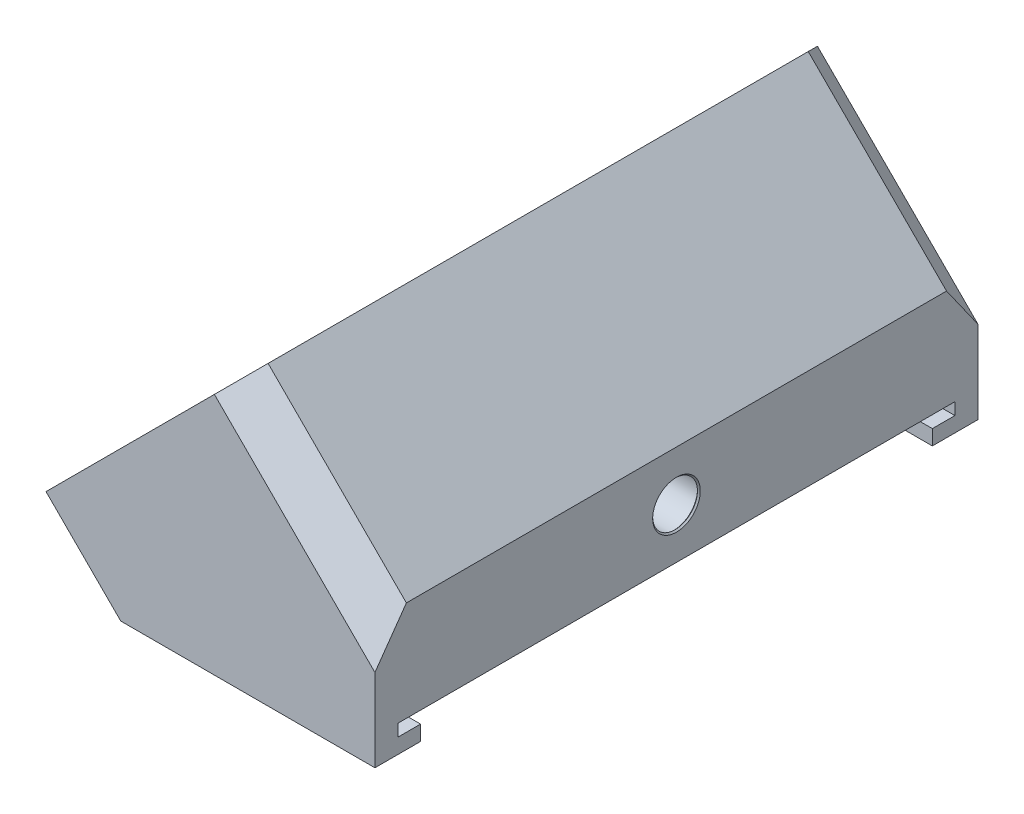
from build123d import *

# Parameters (mm, degrees)
BOSS_EXTRUDE1_DEPTH  = 160.26
SKETCH2_OUTSIDE_W    = 201.942
SKETCH2_OUTSIDE_H    = 157.534
SKETCH2_OUTSIDE_W_2  = 160.26
SKETCH2_OUTSIDE_H_2  = 80
SKETCH2_OUTSIDE_W_3  = 136
SKETCH2_OUTSIDE_H_3  = 74
CUT_EXTRUDE1_DEPTH   = 156
SKETCH11_R           = 1.778
CUT_EXTRUDE8_DEPTH   = 6
BOSS_EXTRUDE14_REACH = 475.056
SKETCH19_W           = 148
SKETCH19_H           = 3.2
CUT_EXTRUDE13_DEPTH  = 79.12
SKETCH24_W           = 136
SKETCH24_H           = 4
CUT_EXTRUDE15_DEPTH  = 3
BOSS_EXTRUDE16_REACH = 475.056
CHAMFER2_SIZE        = 8.36
CUT_EXTRUDE19_REACH  = 467.887
SKETCH31_W           = 25
SKETCH31_H           = 6
SKETCH32_R           = 6.7
CUT_EXTRUDE20_DEPTH  = 10
SKETCH33_R           = 9.2
SKETCH33_R_2         = 6.7
BOSS_EXTRUDE17_DEPTH = 10
SKETCH34_R           = 9
SKETCH34_R_2         = 5.5
BOSS_EXTRUDE18_DEPTH = 2
SKETCH35_R           = 6.7
SKETCH35_R_2         = 5.95
BOSS_EXTRUDE19_DEPTH = 0.75
CHAMFER4_SIZE        = 0.375
SKETCH36_W           = 136
SKETCH36_H           = 25.327231326
SKETCH36_R           = 9.2
BOSS_EXTRUDE20_DEPTH = 10
BOSS_EXTRUDE21_DEPTH = 136
SKETCH38_R           = 2.55
CUT_EXTRUDE23_DEPTH  = 3.8
SKETCH39_R           = 1.8
CUT_EXTRUDE24_DEPTH  = 5


with BuildPart() as part:
    # Sketch1 → Boss-Extrude1 (new body)
    with BuildSketch(Plane.XY):
        Polygon((352.367164448, 53.75754858), (431.734377425, 53.75754858), (431.734377425, 87.527420593), (394.983805142, 124.277992876), (338.415262647, 67.709450381), align=None)
    extrude(amount=BOSS_EXTRUDE1_DEPTH)

    # Sketch2 outside → Cut-Extrude1 (cut)
    # profile 1 of 2: a face of its own
    with BuildSketch(Plane(origin=(135.352906133, -135.352906133, 0), x_dir=(0, 0, 1), z_dir=(-0.7071067811865476, 0.7071067811865476, 0))):
        with Locations((80.13, 335.234)):
            Rectangle(SKETCH2_OUTSIDE_W, SKETCH2_OUTSIDE_H)
        with Locations((80.13, 327.17353859)):
            Rectangle(SKETCH2_OUTSIDE_W_2, SKETCH2_OUTSIDE_H_2, mode=Mode.SUBTRACT)
    # profile 2 of 2: a face of its own
    with BuildSketch(Plane(origin=(135.352906133, -135.352906133, 0), x_dir=(0, 0, 1), z_dir=(-0.7071067811865476, 0.7071067811865476, 0))):
        with Locations((80.13, 327.17353859)):
            Rectangle(SKETCH2_OUTSIDE_W_3, SKETCH2_OUTSIDE_H_3)
    extrude(amount=-CUT_EXTRUDE1_DEPTH, mode=Mode.SUBTRACT)

    # Sketch11 → Cut-Extrude8 (cut)
    with BuildSketch(Plane(origin=(135.352906133, -135.352906133, 0), x_dir=(0, 0, 1), z_dir=(-0.7071067811865476, 0.7071067811865476, 0))):
        with Locations(Location((7.63, 353.58853859, 0), (0, 0, 270))):
            Circle(SKETCH11_R)
        with Locations(Location((7.63, 300.75853859, 0), (0, 0, 270))):
            Circle(SKETCH11_R)
        with Locations(Location((152.63, 353.58853859, 0), (0, 0, 270))):
            Circle(SKETCH11_R)
        with Locations(Location((152.63, 300.75853859, 0), (0, 0, 270))):
            Circle(SKETCH11_R)
    extrude(amount=-CUT_EXTRUDE8_DEPTH, mode=Mode.SUBTRACT)

    # Sketch17 → Boss-Extrude14 (add, up to next)
    with BuildSketch(Plane.XY.offset(12.13), mode=Mode.PRIVATE) as boss_extrude14_sk1:
        Polygon((431.734377425, 83.284779906), (431.734377425, 53.75754858), (428.734377425, 53.75754858), (428.734377425, 86.284779906), align=None)
    boss_extrude14_tool1 = extrude(boss_extrude14_sk1.sketch, amount=BOSS_EXTRUDE14_REACH, mode=Mode.PRIVATE) - part.part
    add(boss_extrude14_tool1.solids().sort_by_distance((430.210205, 69.28325, 12.13))[0])

    # Sketch19 → Cut-Extrude13 (cut)
    with BuildSketch(Plane(origin=(431.734377425, 0, 0), x_dir=(0, 0, -1), z_dir=(1, 0, 0))):
        with Locations((-80.13, 59.35754858)):
            Rectangle(SKETCH19_W, SKETCH19_H)
    extrude(amount=-CUT_EXTRUDE13_DEPTH, mode=Mode.SUBTRACT)

    # Sketch24 → Cut-Extrude15 (cut)
    with BuildSketch(Plane(origin=(431.734377425, 0, 0), x_dir=(0, 0, -1), z_dir=(1, 0, 0))):
        with Locations((-80.13, 55.75754858)):
            Rectangle(SKETCH24_W, SKETCH24_H)
    extrude(amount=-CUT_EXTRUDE15_DEPTH, mode=Mode.SUBTRACT)

    # Sketch29 → Boss-Extrude16 (add, up to next)
    with BuildSketch(Plane.XY.offset(12.13), mode=Mode.PRIVATE) as boss_extrude16_sk1:
        Polygon((356.609805135, 53.75754858), (372.609805135, 53.75754858), (372.609805135, 57.75754858), (352.609805135, 57.75754858), align=None)
    boss_extrude16_tool1 = extrude(boss_extrude16_sk1.sketch, amount=BOSS_EXTRUDE16_REACH, mode=Mode.PRIVATE) - part.part
    add(boss_extrude16_tool1.solids().sort_by_distance((363.572768, 55.831623, 12.13))[0])

    # Chamfer2
    chamfer2_edges = [part.edges().sort_by_distance(p)[0] for p in [
        (413.359091284, 105.902706735, 160.26),
        (345.391213548, 60.733499481, 160.26),
        (345.391213548, 60.733499481, 0),
        (413.359091284, 105.902706735, 0),
    ]]
    chamfer(chamfer2_edges, length=CHAMFER2_SIZE)

    # Sketch31 → Cut-Extrude19 (cut, up to next)
    with BuildSketch(Plane.XZ.offset(-53.75754858), mode=Mode.PRIVATE) as cut_extrude19_sk1:
        with Locations((385.109805135, 151.13)):
            Rectangle(SKETCH31_W, SKETCH31_H)
    cut_extrude19_tool1 = extrude(cut_extrude19_sk1.sketch, amount=-CUT_EXTRUDE19_REACH, mode=Mode.PRIVATE) & part.part
    # Sketch31 → Cut-Extrude19 (cut, up to next)
    with BuildSketch(Plane.XZ.offset(-53.75754858), mode=Mode.PRIVATE) as cut_extrude19_sk2:
        with Locations((385.109805135, 9.13)):
            Rectangle(SKETCH31_W, SKETCH31_H)
    cut_extrude19_tool2 = extrude(cut_extrude19_sk2.sketch, amount=-CUT_EXTRUDE19_REACH, mode=Mode.PRIVATE) & part.part
    add(cut_extrude19_tool1.solids().sort_by_distance((385.109805, 53.757549, 151.13))[0], mode=Mode.SUBTRACT)
    add(cut_extrude19_tool2.solids().sort_by_distance((385.109805, 53.757549, 9.13))[0], mode=Mode.SUBTRACT)

    # Sketch32 → Cut-Extrude20 (cut)
    with BuildSketch(Plane(origin=(431.734377425, 0, 0), x_dir=(0, 0, -1), z_dir=(1, 0, 0))):
        with Locations((-80.13, 74.242484587)):
            Circle(SKETCH32_R)
    extrude(amount=-CUT_EXTRUDE20_DEPTH, mode=Mode.SUBTRACT)

    # Sketch33 → Boss-Extrude17 (add)
    with BuildSketch(Plane.ZY.offset(-428.734377425)):
        with Locations(Location((80.13, 74.242484587, 0), (0, 0, 180))):
            Circle(SKETCH33_R)
        with Locations(Location((80.13, 74.242484587, 0), (0, 0, 180))):
            Circle(SKETCH33_R_2, mode=Mode.SUBTRACT)
    extrude(amount=BOSS_EXTRUDE17_DEPTH)

    # Sketch34 → Boss-Extrude18 (add)
    with BuildSketch(Plane.ZY.offset(-418.734377425)):
        with Locations((80.13, 74.242484587)):
            Circle(SKETCH34_R)
        with Locations((80.13, 74.242484587)):
            Circle(SKETCH34_R_2, mode=Mode.SUBTRACT)
    extrude(amount=-BOSS_EXTRUDE18_DEPTH)

    # Sketch35 → Boss-Extrude19 (add)
    with BuildSketch(Plane(origin=(431.734377425, 0, 0), x_dir=(0, 0, -1), z_dir=(1, 0, 0))):
        with Locations((-80.13, 74.242484587)):
            Circle(SKETCH35_R)
        with Locations((-80.13, 74.242484587)):
            Circle(SKETCH35_R_2, mode=Mode.SUBTRACT)
    extrude(amount=-BOSS_EXTRUDE19_DEPTH)

    # Chamfer4
    chamfer4_edges = [part.edges().sort_by_distance(p)[0] for p in [
        (430.984377425, 74.242484587, 86.08),
        (431.734377425, 74.242484587, 86.08),
    ]]
    chamfer(chamfer4_edges, length=CHAMFER4_SIZE - 0.0001)  # a hair under: the kernel refuses the full size

    # Sketch36 → Boss-Extrude20 (add)
    with BuildSketch(Plane.ZY.offset(-428.734377425)):
        with Locations((80.13, 73.621164243)):
            Rectangle(SKETCH36_W, SKETCH36_H)
        with Locations((80.13, 74.242484587)):
            Circle(SKETCH36_R, mode=Mode.SUBTRACT)
    extrude(amount=BOSS_EXTRUDE20_DEPTH)

    # Sketch37 → Boss-Extrude21 (add)
    with BuildSketch(Plane(origin=(0, 0, 148.13), x_dir=(-1, 0, 0), z_dir=(0, 0, -1))):
        Polygon((-418.734377425, 86.284779906), (-418.734377425, 96.284779906), (-428.734377425, 86.284779906), align=None)
    extrude(amount=BOSS_EXTRUDE21_DEPTH)

    # Sketch38 → Cut-Extrude23 (cut)
    with BuildSketch(Plane.XZ.offset(-60.95754858)):
        with Locations(Location((425.234377425, 120.13, 0), (0, 0, 270))):
            Circle(SKETCH38_R)
        with Locations(Location((425.234377425, 40.13, 0), (0, 0, 270))):
            Circle(SKETCH38_R)
    extrude(amount=-CUT_EXTRUDE23_DEPTH, mode=Mode.SUBTRACT)

    # Sketch39 → Cut-Extrude24 (cut)
    with BuildSketch(Plane.XZ.offset(-64.75754858)):
        with Locations(Location((425.234377425, 120.13, 0), (0, 0, 270))):
            Circle(SKETCH39_R)
        with Locations(Location((425.234377425, 40.13, 0), (0, 0, 270))):
            Circle(SKETCH39_R)
    extrude(amount=-CUT_EXTRUDE24_DEPTH, mode=Mode.SUBTRACT)


solid = part.part
